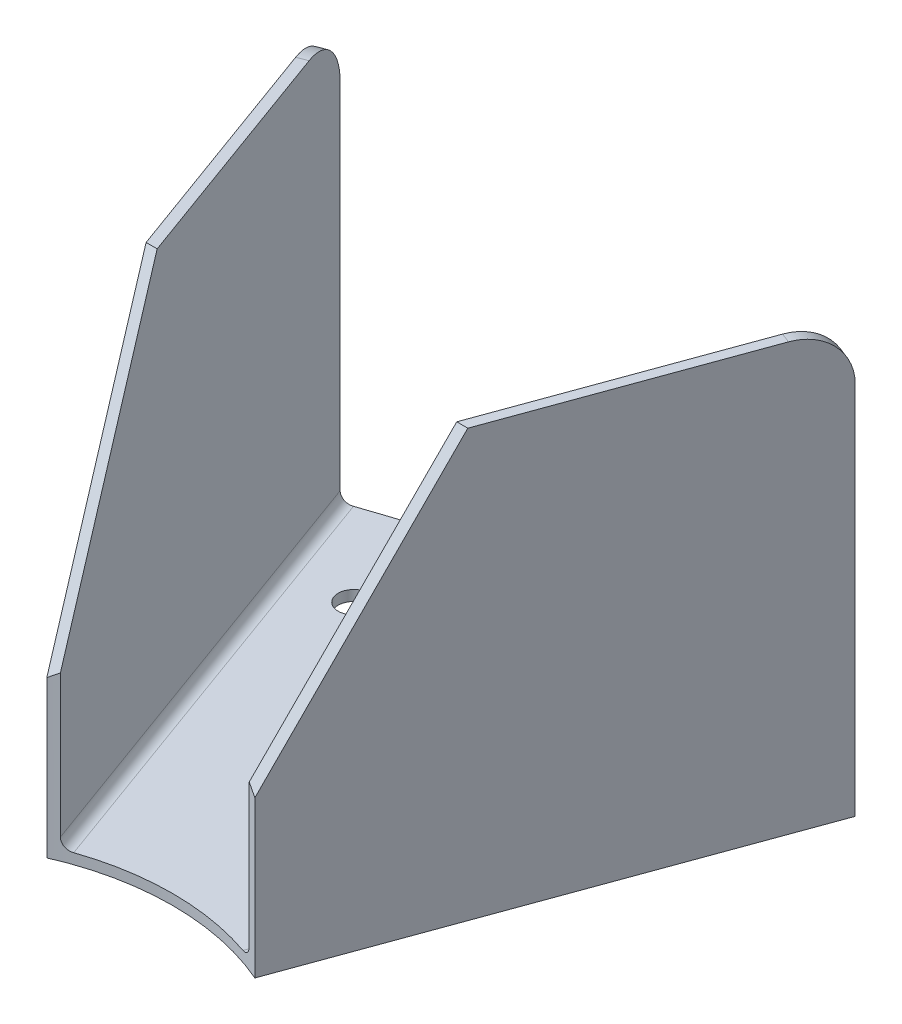
from build123d import *

# Parameters (mm, degrees)
BOSS_EXTRUDE2_DEPTH     = 40
BOSS_EXTRUDE2_2_DEPTH   = 40
BOSS_EXTRUDE3_START     = -1
BOSS_EXTRUDE3_DEPTH     = 1
FILLET1_R               = 1
FILLET2_R               = 5
CUT_EXTRUDE1_DEPTH      = 85.5295373443375
CUT_EXTRUDE1_DEPTH_BACK = 85.5295373443375
SKETCH4_R               = 1.5000000000000004
SKETCH4_R_2             = 1.5000000000000009
SKETCH4_R_3             = 1.4999999999999991
CUT_EXTRUDE2_DEPTH      = 1


with BuildPart() as part:
    # Sketch1 → Boss-Extrude2 (new body)
    with BuildSketch(Plane(origin=(0, 0, 0), x_dir=(1, 0, 0), z_dir=(0, 1, 0))):
        with BuildLine():
            Line((-25.401627045652027, 65.22850100556965), (-10, 22.912878474779202))
            ThreePointArc((-10.000000000000004, 22.912878474779205), (-9.53932578125167, 23.108467358073476), (-9.0748285709005, 23.294795264366854))
            Line((-9.074828570900502, 23.294795264366854), (-24.46711558509191, 65.58475626962223))
            ThreePointArc((-24.46711558509193, 65.58475626962225), (-24.935007566594734, 65.40829762082075), (-25.401627045652038, 65.22850100556964))
        make_face()
    extrude(amount=BOSS_EXTRUDE2_DEPTH)



with BuildPart() as body_2:
    # Sketch1 → Boss-Extrude2 2 (new body)
    with BuildSketch(Plane(origin=(0, 0, 0), x_dir=(1, 0, 0), z_dir=(0, 1, 0))):
        with BuildLine():
            Line((24.46711558509189, 65.58475626962225), (9.074828570900499, 23.294795264366847))
            ThreePointArc((9.0748285709005, 23.294795264366854), (9.53932578125167, 23.108467358073483), (10, 22.912878474779205))
            Line((10, 22.912878474779205), (25.401627045652017, 65.22850100556967))
            ThreePointArc((25.401627045652017, 65.22850100556967), (24.935007566594702, 65.40829762082078), (24.467115585091896, 65.58475626962228))
        make_face()
    extrude(amount=BOSS_EXTRUDE2_2_DEPTH)


with BuildPart() as part_1:
    add(part.part)

    add(body_2.part)  # Boss-Extrude3 merges body 2
    # Sketch1<5> → Boss-Extrude3 (add)
    with BuildSketch(Plane(origin=(0, 0, 0), x_dir=(1, 0, 0), z_dir=(0, 1, 0)).offset(BOSS_EXTRUDE3_START)):
        with BuildLine():
            Line((-25.401627045652027, 65.22850100556965), (-10, 22.912878474779202))
            ThreePointArc((-10, 22.912878474779205), (-8.9e-16, 25), (9.999999999999996, 22.912878474779205))
            Line((10, 22.912878474779205), (25.401627045652017, 65.22850100556967))
            ThreePointArc((25.401627045652017, 65.22850100556967), (-1.421e-14, 70.00000000000003), (-25.401627045652038, 65.22850100556964))
        make_face()
    extrude(amount=BOSS_EXTRUDE3_DEPTH)

    # Fillet1
    fillet1_edges = [part_1.edges().sort_by_distance(p)[0] for p in [
        (16.770972077996195, 0, -44.43977576699454),
        (-16.770972077996205, 0, -44.43977576699454),
    ]]
    fillet(fillet1_edges, radius=FILLET1_R)

    # Fillet2
    # the kernel refuses this fillet: 5 mm, written as the material it takes off along each edge
    with BuildSketch(Plane(origin=(4.656364e-11, 40, 1.1895196e-10), x_dir=(-0.1775518542225804, 0, -0.9841114464643339), z_dir=(0.9841114464643339, 0, -0.1775518542225804))) as fillet2_piece_1:
        with BuildLine():
            CenterArc((70.00000000012774 - FILLET2_R, -FILLET2_R), FILLET2_R, 0, 90)
            Line((70.00000000012774 - FILLET2_R, 0), (70.00000000012774, 0))
            Line((70.00000000012774, 0), (70.00000000012774, -FILLET2_R))
        make_face()
    revolve(axis=Axis((4.656364e-11, 40, 1.1895196e-10), (0, 1, 0)), revolution_arc=21.281391087786062, mode=Mode.SUBTRACT)
    with BuildSketch(Plane(origin=(-2.019185e-11, 40, 5.042011e-11), x_dir=(0.5226263256133499, 0, -0.8525618592078166), z_dir=(0.8525618592078166, 0, 0.5226263256133499))) as fillet2_piece_2:
        with BuildLine():
            CenterArc((70.00000000010422 - FILLET2_R, -FILLET2_R), FILLET2_R, 0, 89.99999999999983)
            Line((70.00000000010422 - FILLET2_R, 0), (70.00000000010422, 0))
            Line((70.00000000010422, 0), (70.00000000010421, -FILLET2_R))
        make_face()
    revolve(axis=Axis((-2.019185e-11, 40, 5.042011e-11), (0, 1, 0)), revolution_arc=21.281391087808515, mode=Mode.SUBTRACT)

    # Sketch3 → Cut-Extrude1 (cut, two sides: drawn at the far end of the back side and taken through both)
    with BuildSketch(Plane(origin=(0, 0, 0), x_dir=(0, 0, -1), z_dir=(1, 0, 0)).offset(-CUT_EXTRUDE1_DEPTH_BACK)):
        Polygon((22.912878474779205, 13.999999999999998), (37.92398547370926, 40), (22.912878474779205, 40), (17.723420287047986, 40), (17.723420287047986, 13.999999999999998), align=None)
    extrude(amount=CUT_EXTRUDE1_DEPTH + CUT_EXTRUDE1_DEPTH_BACK, mode=Mode.SUBTRACT)

    # Sketch4 → Cut-Extrude2 (cut)
    with BuildSketch(Plane(origin=(0, 0, 0), x_dir=(1, 0, 0), z_dir=(0, 1, 0))):
        with Locations(Location((2.4e-16, 40, 0), (0, 0, 270))):
            Circle(SKETCH4_R)
        with Locations(Location((-15.529142706151296, 57.95554957734408, 0), (0, 0, 270))):
            Circle(SKETCH4_R_2)
        with Locations(Location((15.529142706151275, 57.955549577344094, 0), (0, 0, 270))):
            Circle(SKETCH4_R_3)
    extrude(amount=-CUT_EXTRUDE2_DEPTH, mode=Mode.SUBTRACT)


solid = part_1.part
